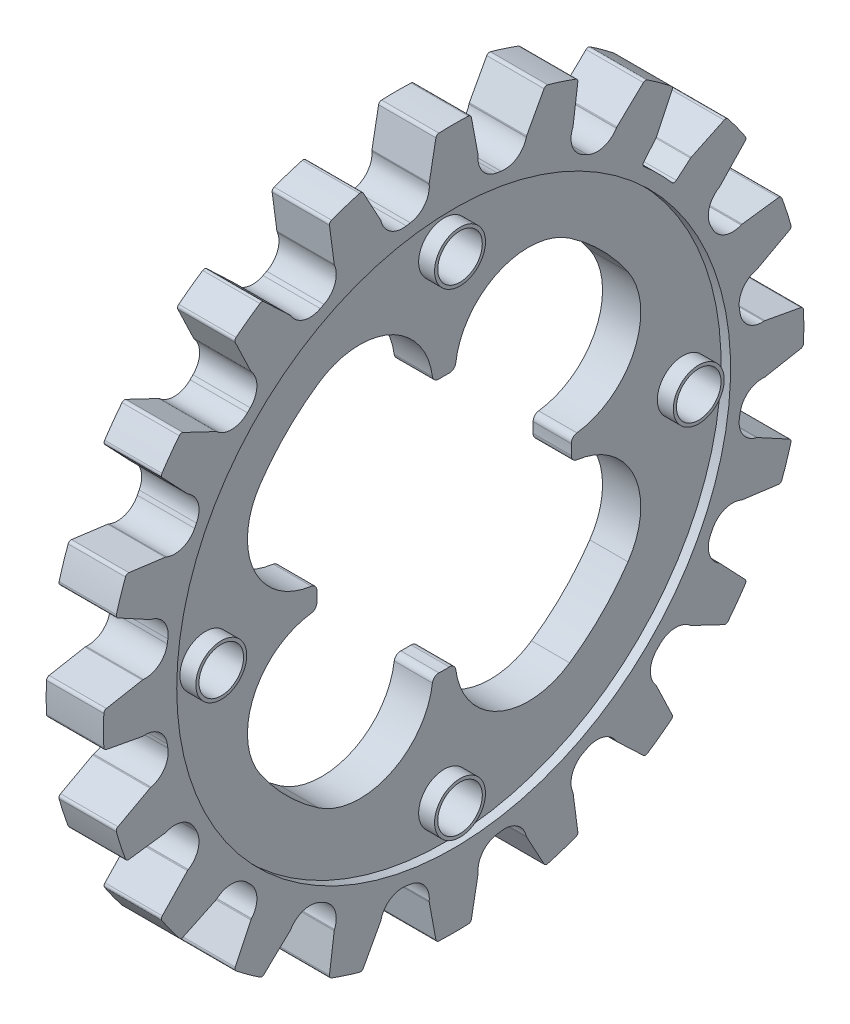
from build123d import *

# Parameters (mm, degrees)
SKETCH_2_W               = 18
SKETCH_2_H               = 70
SKETCH_7_W               = 3
SKETCH_7_H               = 47
SKETCH_8_W               = 32.656678072
SKETCH_8_H               = 45
CUT_REVOLVE_4_ANGLE      = 80
PATTERN_CIRCULAR_1_COUNT = 4
SKETCH_12_W              = 12
SKETCH_12_H              = 7
SKETCH_13_W              = 5
SKETCH_13_H              = 1
PATTERN_CIRCULAR_2_COUNT = 4
SKETCH_15_W              = 42.761373548
SKETCH_15_H              = 27.796364391
CUT_REVOLVE_6_ANGLE      = 9
PATTERN_CIRCULAR_3_COUNT = 20
FILLET_1_R               = 7
CHAMFER_1_SIZE           = 12
CHAMFER_2_SIZE           = 12
FILLET_2_R               = 23
FILLET_4_R               = 1
FILLET_5_R               = 2


with BuildPart() as part:
    # Эскиз2 → Повернуть1 (revolve)
    with BuildSketch(Plane.XY, mode=Mode.PRIVATE) as revolve_1_sk:
        with Locations((9, 75)):
            Rectangle(SKETCH_2_W, SKETCH_2_H)
    revolve(revolve_1_sk.sketch.rotate(Axis((-1000, 0, 0), (1, 0, 0)), 90), axis=Axis((-1000, 0, 0), (1, 0, 0)))

    # Эскиз7 → Вырез-Повернуть3 (revolve, cut)
    with BuildSketch(Plane.XY, mode=Mode.PRIVATE) as cut_revolve_3_sk:
        with Locations((16.5, 63.5)):
            Rectangle(SKETCH_7_W, SKETCH_7_H)
        with Locations((1.5, 63.5)):
            Rectangle(SKETCH_7_W, SKETCH_7_H)
    revolve(cut_revolve_3_sk.sketch.rotate(Axis((-1000, 0, 0), (1, 0, 0)), 90), axis=Axis((-1000, 0, 0), (1, 0, 0)), mode=Mode.SUBTRACT)

    # Эскиз8 → Вырез-Повернуть4 (revolve, symmetric, cut)
    with BuildSketch(Plane(origin=(0, 0, 0), x_dir=(1, 0, 0), z_dir=(0, 0.7071067811865475, 0.7071067811865477))) as cut_revolve_4_sk:
        with Locations((10.734055515, 47.457656292)):
            Rectangle(SKETCH_8_W, SKETCH_8_H)
    cut_revolve_4 = revolve(axis=Axis((-1000, 0, 0), (1, 0, 0)), revolution_arc=CUT_REVOLVE_4_ANGLE / 2, mode=Mode.SUBTRACT)
    cut_revolve_4 = cut_revolve_4 + revolve(cut_revolve_4_sk.sketch, axis=Axis((-1000, 0, 0), (-1, 0, 0)), revolution_arc=CUT_REVOLVE_4_ANGLE / 2, mode=Mode.SUBTRACT)

    # Круговой массив1: Вырез-Повернуть4 ×4 about axis
    pattern_circular_1_axis = Axis((-1000, 0, 0), (-1, 0, 0))
    for i in range(1, PATTERN_CIRCULAR_1_COUNT):
        add(cut_revolve_4.rotate(pattern_circular_1_axis, i * 360 / PATTERN_CIRCULAR_1_COUNT), mode=Mode.SUBTRACT)

    # Эскиз12 → Вырез-Повернуть5 (revolve, cut)
    with BuildSketch(Plane.XY, mode=Mode.PRIVATE) as cut_revolve_5_sk:
        with Locations((9, 78.5)):
            Rectangle(SKETCH_12_W, SKETCH_12_H)
    cut_revolve_5 = revolve(cut_revolve_5_sk.sketch.rotate(Axis((3, 75, 0), (1, 0, 0)), 90), axis=Axis((3, 75, 0), (1, 0, 0)), mode=Mode.SUBTRACT)

    # Эскиз13 → Повернуть3 (revolve)
    with BuildSketch(Plane.XY, mode=Mode.PRIVATE) as revolve_3_sk:
        with Locations((17.5, 82.5)):
            Rectangle(SKETCH_13_W, SKETCH_13_H)
        with Locations((0.5, 82.5)):
            Rectangle(SKETCH_13_W, SKETCH_13_H)
    revolve_3 = revolve(revolve_3_sk.sketch.rotate(Axis((23.468116381, 75, 0), (-1, 0, 0)), 90), axis=Axis((23.468116381, 75, 0), (-1, 0, 0)))

    # Круговой массив2: Вырез-Повернуть5, Повернуть3 ×4 about axis
    pattern_circular_2_axis = Axis((0, 0, 0), (1, 0, 0))
    add([cut_revolve_5.rotate(pattern_circular_2_axis, i * 360 / PATTERN_CIRCULAR_2_COUNT) for i in range(1, PATTERN_CIRCULAR_2_COUNT)], mode=Mode.SUBTRACT)
    add([revolve_3.rotate(pattern_circular_2_axis, i * 360 / PATTERN_CIRCULAR_2_COUNT) for i in range(1, PATTERN_CIRCULAR_2_COUNT)])

    # Эскиз15 → Вырез-Повернуть6 (revolve, symmetric, cut)
    with BuildSketch(Plane(origin=(0, 0, 0), x_dir=(1, 0, 0), z_dir=(0, 0.7071067811865475, 0.7071067811865477))) as cut_revolve_6_sk:
        with Locations((21.380686774, 104.898182195)):
            Rectangle(SKETCH_15_W, SKETCH_15_H)
    cut_revolve_6 = revolve(axis=Axis((142.017291929, 0, 0), (-1, 0, 0)), revolution_arc=CUT_REVOLVE_6_ANGLE / 2, mode=Mode.SUBTRACT)
    cut_revolve_6 = cut_revolve_6 + revolve(cut_revolve_6_sk.sketch, axis=Axis((142.017291929, 0, 0), (1, 0, 0)), revolution_arc=CUT_REVOLVE_6_ANGLE / 2, mode=Mode.SUBTRACT)

    # Круговой массив3: Вырез-Повернуть6 ×20 about axis
    pattern_circular_3_axis = Axis((0, 0, 0), (1, 0, 0))
    for i in range(1, PATTERN_CIRCULAR_3_COUNT):
        add(cut_revolve_6.rotate(pattern_circular_3_axis, i * 360 / PATTERN_CIRCULAR_3_COUNT), mode=Mode.SUBTRACT)

    # Скругление1
    fillet_1_edges = [part.edges().sort_by_distance(p)[0] for p in [
        (9, 34.824192345, -84.073037459),
        (9, 47.547369389, -77.590254956),
        (9, 7.139777711, -90.71947737),
        (9, 21.243528111, -88.485662756),
        (9, -21.243528111, -88.485662756),
        (9, -7.139777711, -90.71947737),
        (9, -47.547369389, -77.590254956),
        (9, -34.824192345, -84.073037459),
        (9, -69.19694287, -59.099772398),
        (9, -59.099772398, -69.19694287),
        (9, -84.073037459, -34.824192345),
        (9, -77.590254956, -47.547369389),
        (9, -90.71947737, -7.139777711),
        (9, -88.485662756, -21.243528111),
        (9, -88.485662756, 21.243528111),
        (9, -90.71947737, 7.139777711),
        (9, -77.590254956, 47.547369389),
        (9, -84.073037459, 34.824192345),
        (9, -59.099772398, 69.19694287),
        (9, -69.19694287, 59.099772398),
        (9, -34.824192345, 84.073037459),
        (9, -47.547369389, 77.590254956),
        (9, -7.139777711, 90.71947737),
        (9, -21.243528111, 88.485662756),
        (9, 21.243528111, 88.485662756),
        (9, 7.139777711, 90.71947737),
        (9, 47.547369389, 77.590254956),
        (9, 34.824192345, 84.073037459),
        (9, 69.19694287, 59.099772398),
        (9, 59.099772398, 69.19694287),
        (9, 84.073037459, 34.824192345),
        (9, 77.590254956, 47.547369389),
        (9, 90.71947737, 7.139777711),
        (9, 88.485662756, 21.243528111),
        (9, 88.485662756, -21.243528111),
        (9, 90.71947737, -7.139777711),
        (9, 77.590254956, -47.547369389),
        (9, 84.073037459, -34.824192345),
    ]]
    fillet(fillet_1_edges, radius=FILLET_1_R)

    # Фаска1
    # the kernel refuses this chamfer: 12, 3.215390309 mm, written as the material it takes off along each edge
    with BuildSketch(Plane(origin=(49.160658842, 83.644656216, -71.439285316), x_dir=(0, 0.6383075794973635, 0.7697814195966391), z_dir=(-1, 0, 0)), Plane(origin=(49.160658842, 57.474842119, -93.790418079), x_dir=(0, 0.8449421234909902, 0.534857745527291), z_dir=(-1, 0, 0)), Plane(origin=(49.160658842, 25.678990024, -106.960691244), x_dir=(0, 0.9688678453793731, 0.24757846875269904), z_dir=(-1, 0, 0)), Plane(origin=(49.160658842, -8.63050053, -109.660906711), x_dir=(0, 0.9979540320628092, -0.06393551352403411), z_dir=(-1, 0, 0)), Plane(origin=(49.160658842, -42.09517756, -101.626748576), x_dir=(0, 0.9293535249333414, -0.36919104227211835), z_dir=(-1, 0, 0)), Plane(origin=(49.160658842, -71.439285316, -83.644656216), x_dir=(0, 0.7697814195966365, -0.6383075794973665), z_dir=(-1, 0, 0)), Plane(origin=(49.160658842, -93.790418079, -57.474842119), x_dir=(0, 0.5348577455272931, -0.8449421234909887), z_dir=(-1, 0, 0)), Plane(origin=(49.160658842, -106.960691244, -25.678990024), x_dir=(0, 0.2475784687526962, -0.9688678453793739), z_dir=(-1, 0, 0)), Plane(origin=(49.160658842, -109.660906711, 8.63050053), x_dir=(0, -0.06393551352403433, -0.997954032062809), z_dir=(-1, 0, 0)), Plane(origin=(49.160658842, -101.626748576, 42.09517756), x_dir=(0, -0.3691910422721168, -0.929353524933342), z_dir=(-1, 0, 0))) as chamfer_1_piece_1:
        with BuildLine():
            Line((3.203232837, 0), (CHAMFER_1_SIZE * 0.0145601492604, -CHAMFER_1_SIZE * 0.999893995408))
            Line((CHAMFER_1_SIZE * 0.0145601492604, -CHAMFER_1_SIZE * 0.999893995408), (0, 0))
            ThreePointArc((0, 0), (1.660233242, 0.011644887), (3.203232837, 0))
        make_face()
    extrude(amount=80.321317685, mode=Mode.SUBTRACT)
    with BuildSketch(Plane(origin=(49.160658842, -83.644656216, 71.439285316), x_dir=(0, 0.7604059656000313, -0.6494480483301834), z_dir=(-1, 0, 0)), Plane(origin=(49.160658842, -57.474842119, 93.790418079), x_dir=(0, 0.5224985647159491, -0.8526401643540921), z_dir=(-1, 0, 0)), Plane(origin=(49.160658842, -25.678990024, 106.960691244), x_dir=(0, 0.23344536385590578, -0.9723699203976766), z_dir=(-1, 0, 0)), Plane(origin=(49.160658842, 8.63050053, 109.660906711), x_dir=(0, -0.07845909572784487, -0.996917333733128), z_dir=(-1, 0, 0)), Plane(origin=(49.160658842, 42.09517756, 101.626748576), x_dir=(0, -0.38268343236508945, -0.9238795325112868), z_dir=(-1, 0, 0)), Plane(origin=(49.160658842, 71.439285316, 83.644656216), x_dir=(0, -0.6494480483301834, -0.7604059656000313), z_dir=(-1, 0, 0)), Plane(origin=(49.160658842, 93.790418079, 57.474842119), x_dir=(0, -0.8526401643540924, -0.5224985647159486), z_dir=(-1, 0, 0)), Plane(origin=(49.160658842, 106.960691244, 25.678990024), x_dir=(0, -0.9723699203976764, -0.23344536385590603), z_dir=(-1, 0, 0)), Plane(origin=(49.160658842, 109.660906711, -8.63050053), x_dir=(0, -0.996917333733128, 0.07845909572784465), z_dir=(-1, 0, 0)), Plane(origin=(49.160658842, 101.626748576, -42.09517756), x_dir=(0, -0.9238795325112868, 0.38268343236508934), z_dir=(-1, 0, 0))) as chamfer_1_piece_2:
        with BuildLine():
            Line((CHAMFER_1_SIZE, 0), (0.046639548, 3.20289328))
            ThreePointArc((0.046639548, 3.20289328), (0.012529591, 1.660226801), (0, 0))
            Line((0, 0), (CHAMFER_1_SIZE, 0))
        make_face()
    extrude(amount=80.321317685, mode=Mode.SUBTRACT)

    # Фаска2
    # the kernel refuses this chamfer: 12, 3.215390309 mm, written as the material it takes off along each edge
    with BuildSketch(Plane(origin=(49.160658842, 71.439285316, -83.644656216), x_dir=(0, -0.7697814195966384, -0.6383075794973644), z_dir=(-1, 0, 0)), Plane(origin=(49.160658842, 42.09517756, -101.626748576), x_dir=(0, -0.9293535249333433, -0.36919104227211375), z_dir=(-1, 0, 0)), Plane(origin=(49.160658842, 8.63050053, -109.660906711), x_dir=(0, -0.997954032062809, -0.06393551352403468), z_dir=(-1, 0, 0)), Plane(origin=(49.160658842, -25.678990024, -106.960691244), x_dir=(0, -0.9688678453793736, 0.2475784687526967), z_dir=(-1, 0, 0)), Plane(origin=(49.160658842, -57.474842119, -93.790418079), x_dir=(0, -0.8449421234909889, 0.534857745527293), z_dir=(-1, 0, 0)), Plane(origin=(49.160658842, -83.644656216, -71.439285316), x_dir=(0, -0.6383075794973648, 0.769781419596638), z_dir=(-1, 0, 0)), Plane(origin=(49.160658842, -101.626748576, -42.09517756), x_dir=(0, -0.3691910422721168, 0.929353524933342), z_dir=(-1, 0, 0)), Plane(origin=(49.160658842, -109.660906711, -8.63050053), x_dir=(0, -0.06393551352403433, 0.997954032062809), z_dir=(-1, 0, 0)), Plane(origin=(49.160658842, -106.960691244, 25.678990024), x_dir=(0, 0.24757846875269515, 0.9688678453793742), z_dir=(-1, 0, 0)), Plane(origin=(49.160658842, -93.790418079, 57.474842119), x_dir=(0, 0.5348577455272931, 0.8449421234909887), z_dir=(-1, 0, 0)), Plane(origin=(49.160658842, -71.439285316, 83.644656216), x_dir=(0, 0.7697814195966387, 0.6383075794973639), z_dir=(-1, 0, 0)), Plane(origin=(49.160658842, -42.09517756, 101.626748576), x_dir=(0, 0.9293535249333406, 0.3691910422721207), z_dir=(-1, 0, 0)), Plane(origin=(49.160658842, -8.63050053, 109.660906711), x_dir=(0, 0.9979540320628087, 0.0639355135240388), z_dir=(-1, 0, 0)), Plane(origin=(49.160658842, 25.678990024, 106.960691244), x_dir=(0, 0.9688678453793736, -0.2475784687526969), z_dir=(-1, 0, 0)), Plane(origin=(49.160658842, 57.474842119, 93.790418079), x_dir=(0, 0.8449421234909851, -0.5348577455272993), z_dir=(-1, 0, 0)), Plane(origin=(49.160658842, 83.644656216, 71.439285316), x_dir=(0, 0.6383075794973608, -0.7697814195966413), z_dir=(-1, 0, 0)), Plane(origin=(49.160658842, 101.626748576, 42.09517756), x_dir=(0, 0.369191042272116, -0.9293535249333424), z_dir=(-1, 0, 0)), Plane(origin=(49.160658842, 109.660906711, 8.63050053), x_dir=(0, 0.06393551352403506, -0.997954032062809), z_dir=(-1, 0, 0)), Plane(origin=(49.160658842, 106.960691244, -25.678990024), x_dir=(0, -0.24757846875269884, -0.9688678453793731), z_dir=(-1, 0, 0)), Plane(origin=(49.160658842, 93.790418079, -57.474842119), x_dir=(0, -0.5348577455272955, -0.8449421234909873), z_dir=(-1, 0, 0))) as chamfer_2_piece_1:
        with BuildLine():
            Line((3.203232837, 0), (CHAMFER_2_SIZE * 0.0145601492604, CHAMFER_2_SIZE * 0.999893995408))
            Line((CHAMFER_2_SIZE * 0.0145601492604, CHAMFER_2_SIZE * 0.999893995408), (0, 0))
            ThreePointArc((0, 0), (1.660233242, -0.011644887), (3.203232837, 0))
        make_face()
    extrude(amount=80.321317685, mode=Mode.SUBTRACT)

    # Скругление2
    fillet_2_edges = [part.edges().sort_by_distance(p)[0] for p in [
        (9, 6.097211495, -69.691446289),
        (9, 69.691446289, -6.097211495),
        (9, 69.691446289, 6.097211495),
        (9, 6.097211495, 69.691446289),
        (9, -6.097211495, 69.691446289),
        (9, -69.691446289, 6.097211495),
        (9, -69.691446289, -6.097211495),
        (9, -6.097211495, -69.691446289),
    ]]
    fillet(fillet_2_edges, radius=FILLET_2_R)

    # Скругление4
    fillet_4_edges = [part.edges().sort_by_distance(p)[0] for p in [
        (9, 59.099772398, -69.19694287),
        (9, 69.19694287, -59.099772398),
        (9, 106.167639763, 28.782499321),
        (9, 95.292252199, 22.877645658),
        (9, 92.077144185, 60.181388474),
        (9, 83.558736107, 51.204859342),
        (9, 68.973496196, 85.689304015),
        (9, 63.645908736, 74.519784629),
        (9, 39.118241832, 102.809353446),
        (9, 37.502976372, 90.540194186),
        (9, 5.433821404, 109.865707047),
        (9, 7.688991381, 97.697898706),
        (9, -28.782499321, 106.167639763),
        (9, -22.877645658, 95.292252199),
        (9, -60.181388474, 92.077144185),
        (9, -51.204859342, 83.558736107),
        (9, -85.689304015, 68.973496196),
        (9, -74.519784629, 63.645908736),
        (9, -102.809353446, 39.118241832),
        (9, -90.540194186, 37.502976372),
        (9, -109.865707047, 5.433821404),
        (9, -97.697898706, 7.688991381),
        (9, -106.167639763, -28.782499321),
        (9, -95.292252199, -22.877645658),
        (9, -92.077144185, -60.181388474),
        (9, -83.558736107, -51.204859342),
        (9, -68.973496196, -85.689304015),
        (9, -63.645908736, -74.519784629),
        (9, -39.118241832, -102.809353446),
        (9, -37.502976372, -90.540194186),
        (9, -5.433821404, -109.865707047),
        (9, -7.688991381, -97.697898706),
        (9, 28.782499321, -106.167639763),
        (9, 22.877645658, -95.292252199),
        (9, 60.181388474, -92.077144185),
        (9, 51.204859342, -83.558736107),
        (9, 85.689304015, -68.973496196),
        (9, 74.519784629, -63.645908736),
        (9, 102.809353446, -39.118241832),
        (9, 90.540194186, -37.502976372),
        (9, 109.865707047, -5.433821404),
        (9, 97.697898706, -7.688991381),
        (9, 37.502976372, -90.540194186),
        (9, 39.118241832, -102.809353446),
        (9, 7.688991381, -97.697898706),
        (9, 5.433821404, -109.865707047),
        (9, -22.877645658, -95.292252199),
        (9, -28.782499321, -106.167639763),
        (9, -51.204859342, -83.558736107),
        (9, -60.181388474, -92.077144185),
        (9, -74.519784629, -63.645908736),
        (9, -85.689304015, -68.973496196),
        (9, -90.540194186, -37.502976372),
        (9, -102.809353446, -39.118241832),
        (9, -97.697898706, -7.688991381),
        (9, -109.865707047, -5.433821404),
        (9, -95.292252199, 22.877645658),
        (9, -106.167639763, 28.782499321),
        (9, -83.558736107, 51.204859342),
        (9, -92.077144185, 60.181388474),
        (9, -63.645908736, 74.519784629),
        (9, -68.973496196, 85.689304015),
        (9, -37.502976372, 90.540194186),
        (9, -39.118241832, 102.809353446),
        (9, -7.688991381, 97.697898706),
        (9, -5.433821404, 109.865707047),
        (9, 22.877645658, 95.292252199),
        (9, 28.782499321, 106.167639763),
        (9, 51.204859342, 83.558736107),
        (9, 60.181388474, 92.077144185),
        (9, 74.519784629, 63.645908736),
        (9, 85.689304015, 68.973496196),
        (9, 90.540194186, 37.502976372),
        (9, 102.809353446, 39.118241832),
        (9, 63.645908736, -74.519784629),
        (9, 68.973496196, -85.689304015),
        (9, 83.558736107, -51.204859342),
        (9, 92.077144185, -60.181388474),
        (9, 95.292252199, -22.877645658),
        (9, 106.167639763, -28.782499321),
        (9, 97.697898706, 7.688991381),
        (9, 109.865707047, 5.433821404),
    ]]
    fillet(fillet_4_edges, radius=FILLET_4_R)

    # Скругление5
    fillet_5_edges = [part.edges().sort_by_distance(p)[0] for p in [
        (9, -39.847787924, -3.48622971),
        (9, -39.847787924, 3.48622971),
        (9, 39.847787924, 3.48622971),
        (9, 3.48622971, -39.847787924),
        (9, -3.48622971, -39.847787924),
        (9, 39.847787924, -3.48622971),
        (9, -3.48622971, 39.847787924),
        (9, 3.48622971, 39.847787924),
    ]]
    fillet(fillet_5_edges, radius=FILLET_5_R)


solid = part.part
